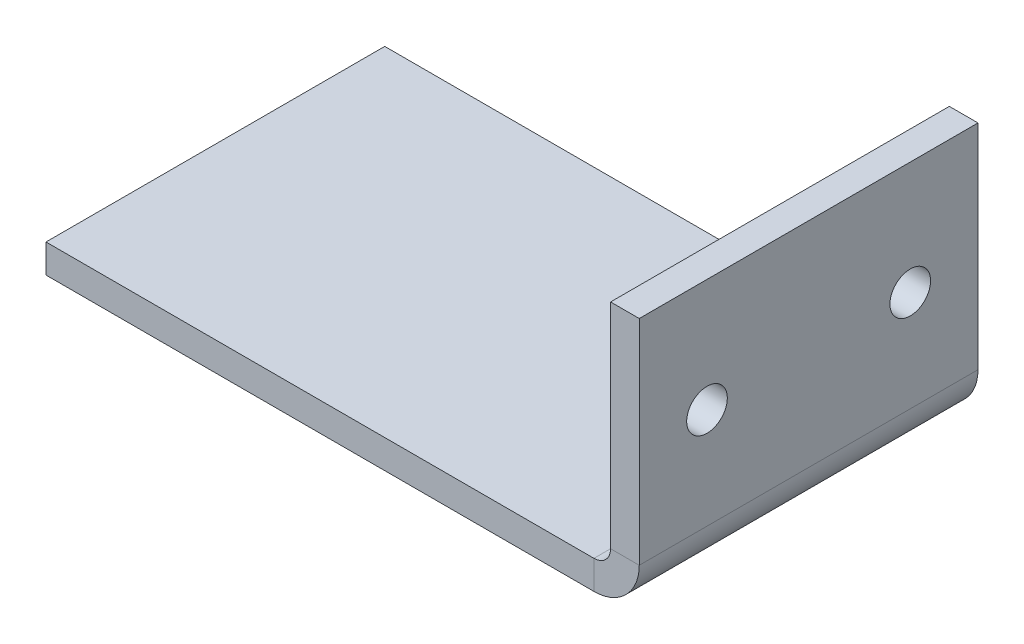
from build123d import *

# Parameters (mm, degrees)
SKETCH1_W                    = 25
SKETCH1_H                    = 15
BASE_FLANGE1_DEPTH           = 1.27
EDGE_FLANGE1_STRIP_W         = 6.5532
EDGE_FLANGE1_STRIP_H         = 1.27
EDGE_FLANGE1_STRIP_CUT_DEPTH = 15
EDGE_FLANGE1_DEPTH           = 15
M1_6_CLEARANCE_HOLE1_D       = 1.8


# Sheet-metal steps are written as plain solids
with BuildPart() as part:
    # Sketch1 → Base-Flange1 (new body)
    with BuildSketch(Plane(origin=(0, 0, 0), x_dir=(1, 0, 0), z_dir=(0, 1, 0))):
        Rectangle(SKETCH1_W, SKETCH1_H)
    extrude(amount=-BASE_FLANGE1_DEPTH)

    # Edge-Flange1 strip (across the edge) → Edge-Flange1 strip cut (cut)
    with BuildSketch(Plane(origin=(12.5, 0, 7.5), x_dir=(-1, 0, 0), z_dir=(0, 0, -1))):
        with Locations((-2.54, -0.635)):
            Rectangle(EDGE_FLANGE1_STRIP_W, EDGE_FLANGE1_STRIP_H)
    extrude(amount=EDGE_FLANGE1_STRIP_CUT_DEPTH, mode=Mode.SUBTRACT)

    # Edge-Flange1 section (across the edge) → Edge-Flange1 (add)
    with BuildSketch(Plane(origin=(12.5, 0, 7.5), x_dir=(-1, 0, 0), z_dir=(0, 0, -1))):
        with BuildLine():
            Line((-1.27, 0.7366), (-1.27, 10.2))
            Line((-1.27, 10.2), (0, 10.2))
            Line((0, 10.2), (0, 0.7366))
            ThreePointArc((0, 0.7366), (0.215745145, 0.215745145), (0.7366, 0))
            Line((0.7366, 0), (0.7366, -1.27))
            ThreePointArc((0.7366, -1.27), (-0.682280467, -0.682280467), (-1.27, 0.7366))
        make_face()
    extrude(amount=EDGE_FLANGE1_DEPTH)

    # M1.6 Clearance Hole1 (through all)
    with Locations(Plane(origin=(13.77, 5.2, 4.5), x_dir=(0, 1, 0), z_dir=(1, 0, 0))):
        with Locations((0, 0), (0, -9)):
            Hole(M1_6_CLEARANCE_HOLE1_D / 2)


solid = part.part
